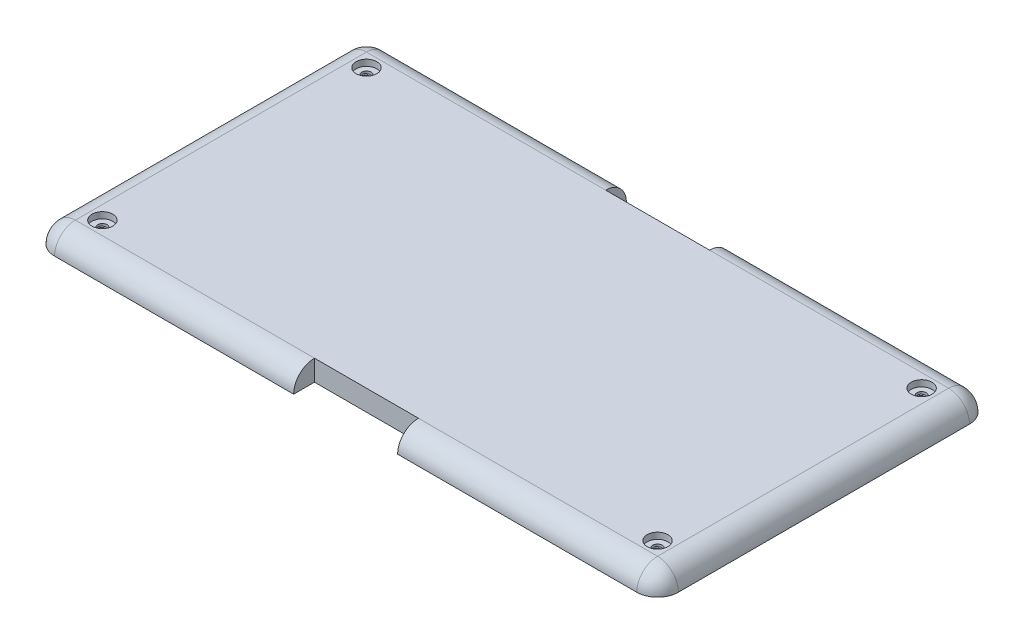
from build123d import *

# Parameters (mm, degrees)
ESQUISSE1_W             = 300
ESQUISSE1_H             = 160
BOSS_EXTRU_1_DEPTH      = 10
CONG_1_R                = 10
CONG_2_R                = 10
CONG_4_R                = 10
ESQUISSE2_R             = 5
ESQUISSE2_R_2           = 2
ENL_V_MAT_EXTRU_1_DEPTH = 3
ESQUISSE4_R             = 2.25
ENL_V_MAT_EXTRU_2_DEPTH = 13
ESQUISSE5_R             = 2.25
ENL_V_MAT_EXTRU_3_DEPTH = 13
ESQUISSE7_W             = 25
ESQUISSE7_H             = 22.883297183
ESQUISSE7_H_2           = 22.436620545
ENL_V_MAT_EXTRU_5_DEPTH = 25
FILETAGE1_PITCH         = 0.8
FILETAGE2_PITCH         = 0.8
FILETAGE3_PITCH         = 0.8
FILETAGE4_PITCH         = 0.8


with BuildPart() as part:
    # Esquisse1 → Boss.-Extru.1 (new body)
    with BuildSketch(Plane(origin=(0, 0, 0), x_dir=(1, 0, 0), z_dir=(0, 1, 0))):
        Rectangle(ESQUISSE1_W, ESQUISSE1_H)
    extrude(amount=BOSS_EXTRU_1_DEPTH)

    # Congé1
    cong_1_edges = [part.edges().sort_by_distance(p)[0] for p in [
        (-150, 5, -80),
    ]]
    fillet(cong_1_edges, radius=CONG_1_R)

    # Congé2
    cong_2_edges = [part.edges().sort_by_distance(p)[0] for p in [
        (150, 5, -80),
        (150, 5, 80),
        (-150, 5, 80),
    ]]
    fillet(cong_2_edges, radius=CONG_2_R)

    # Congé4
    cong_4_edges = [part.edges().sort_by_distance(p)[0] for p in [
        (-147.071067812, 10, -77.071067812),
        (0, 10, -80),
        (147.071067812, 10, -77.071067812),
        (150, 10, 0),
        (147.071067812, 10, 77.071067812),
        (0, 10, 80),
        (-147.071067812, 10, 77.071067812),
        (-150, 10, 0),
    ]]
    fillet(cong_4_edges, radius=CONG_4_R - 0.0001)  # a hair under: the kernel refuses the full size

    # Esquisse2 → Enlèv. mat.-Extru.1 (cut)
    # profile 1 of 4: a face of its own
    with BuildSketch(Plane(origin=(0, 10, 0), x_dir=(1, 0, 0), z_dir=(0, 1, 0))):
        with Locations(Location((-133.5, 63.5, 0), (0, 0, 270))):
            Circle(ESQUISSE2_R)
    # profile 2 of 4: a face of its own
    with BuildSketch(Plane(origin=(0, 10, 0), x_dir=(1, 0, 0), z_dir=(0, 1, 0))):
        with Locations(Location((-133.5, -63.5, 0), (0, 0, 270))):
            Circle(ESQUISSE2_R)
    # profile 3 of 4: a face of its own
    with BuildSketch(Plane(origin=(0, 10, 0), x_dir=(1, 0, 0), z_dir=(0, 1, 0))):
        with Locations(Location((133.5, -63.5, 0), (0, 0, 270))):
            Circle(ESQUISSE2_R)
        with Locations(Location((133.5, -63.5, 0), (0, 0, 270))):
            Circle(ESQUISSE2_R_2, mode=Mode.SUBTRACT)
    # profile 4 of 4: a face of its own
    with BuildSketch(Plane(origin=(0, 10, 0), x_dir=(1, 0, 0), z_dir=(0, 1, 0))):
        with Locations(Location((133.5, 63.5, 0), (0, 0, 270))):
            Circle(ESQUISSE2_R)
    extrude(amount=-ENL_V_MAT_EXTRU_1_DEPTH, mode=Mode.SUBTRACT)

    # Esquisse4 → Enlèv. mat.-Extru.2 (cut)
    with BuildSketch(Plane(origin=(0, 10, 0), x_dir=(1, 0, 0), z_dir=(0, 1, 0))):
        with Locations(Location((133.5, -63.5, 0), (0, 0, 270))):
            Circle(ESQUISSE4_R)
    extrude(amount=-ENL_V_MAT_EXTRU_2_DEPTH, mode=Mode.SUBTRACT)

    # Esquisse5 → Enlèv. mat.-Extru.3 (cut)
    with BuildSketch(Plane(origin=(0, 7, 0), x_dir=(1, 0, 0), z_dir=(0, 1, 0))):
        with Locations(Location((133.5, 63.5, 0), (0, 0, 270))):
            Circle(ESQUISSE5_R)
        with Locations(Location((-133.5, 63.5, 0), (0, 0, 270))):
            Circle(ESQUISSE5_R)
        with Locations(Location((-133.5, -63.5, 0), (0, 0, 270))):
            Circle(ESQUISSE5_R)
    extrude(amount=-ENL_V_MAT_EXTRU_3_DEPTH, mode=Mode.SUBTRACT)

    # Esquisse7 → Enlèv. mat.-Extru.5 (cut, symmetric)
    with BuildSketch(Plane(origin=(0, 10, 0), x_dir=(1, 0, 0), z_dir=(0, 1, 0))):
        with Locations((-12.5, 81.441648592)):
            Rectangle(ESQUISSE7_W, ESQUISSE7_H)
        with Locations((12.5, 81.441648592)):
            Rectangle(ESQUISSE7_W, ESQUISSE7_H)
        with Locations((-12.5, -81.218310273)):
            Rectangle(ESQUISSE7_W, ESQUISSE7_H_2)
        with Locations((12.5, -81.218310273)):
            Rectangle(ESQUISSE7_W, ESQUISSE7_H_2)
    extrude(amount=ENL_V_MAT_EXTRU_5_DEPTH, both=True, mode=Mode.SUBTRACT)

    # Filetage1: arcs per turn and ends read off the stored shape
    # Filetage1: the profile of Profil de filetage1 profile screwed along a right-hand helix through 6.25 turns, 8 arcs to a turn; built about Z, then put on its axis
    filetage1_z = Axis((0, 0, 0), (0, 0, 1))
    filetage1_corners = [(2.2503, 0, -0.000173205), (2.2503, 0, 0.700173203), (1.8169873, 0, 0.449999999), (1.8169873, 0, 0.249999999)]
    with BuildLine(mode=Mode.PRIVATE) as filetage1_profile:
        Line(filetage1_corners[0], filetage1_corners[1])
        Line(filetage1_corners[1], filetage1_corners[2])
        Line(filetage1_corners[2], filetage1_corners[3])
        Line(filetage1_corners[3], filetage1_corners[0])
    filetage1_cap = Face(filetage1_profile.wire())
    filetage1_turn_angles = [0, 22.5, 45, 67.5, 90, 112.5, 135, 157.5, 180, 202.5, 225, 247.5, 270, 292.5, 315, 337.5, 360]
    filetage1_turn_weights = [1, 0.9238795325112867, 1, 0.9238795325112867, 1, 0.9238795325112867, 1, 0.9238795325112867, 1, 0.9238795325112867, 1, 0.9238795325112867, 1, 0.9238795325112867, 1, 0.9238795325112867, 1]
    filetage1_turn_rails = [Edge.make_bspline([Vector(p[0], p[1], 0).rotate(filetage1_z, filetage1_turn_angles[k]) / filetage1_turn_weights[k] + Vector(0, 0, p[2] + FILETAGE1_PITCH * filetage1_turn_angles[k] / 360) for k in range(17)], [0, 0, 0, 1, 1, 2, 2, 3, 3, 4, 4, 5, 5, 6, 6, 7, 7, 8, 8, 8], 2, filetage1_turn_weights) for p in filetage1_corners]
    filetage1_turn_sides = [Face.make_surface_from_curves(filetage1_turn_rails[p[0]], filetage1_turn_rails[p[1]]) for p in [(0, 1), (1, 2), (2, 3), (3, 0)]]
    filetage1_last_angles = [2160, 2182.5, 2205, 2227.5, 2250]
    filetage1_last_weights = [1, 0.9238795325112867, 1, 0.9238795325112867, 1]
    filetage1_last_rails = [Edge.make_bspline([Vector(p[0], p[1], 0).rotate(filetage1_z, filetage1_last_angles[k]) / filetage1_last_weights[k] + Vector(0, 0, p[2] + FILETAGE1_PITCH * filetage1_last_angles[k] / 360) for k in range(5)], [0, 0, 0, 1, 1, 2, 2, 2], 2, filetage1_last_weights) for p in filetage1_corners]
    filetage1_last_sides = [Face.make_surface_from_curves(filetage1_last_rails[p[0]], filetage1_last_rails[p[1]]) for p in [(0, 1), (1, 2), (2, 3), (3, 0)]]
    filetage1 = Plane(origin=(-133.5, 6, -63.5), x_dir=(-1, 0, 0), z_dir=(0, -1, 0)) * Solid(Shell([*[p.moved(Location((0, 0, FILETAGE1_PITCH * i))) for i in range(6) for p in filetage1_turn_sides], *filetage1_last_sides, filetage1_cap, filetage1_cap.rotate(filetage1_z, 2250).moved(Location((0, 0, FILETAGE1_PITCH * 2250 / 360)))]))
    add(filetage1)

    # Filetage2: arcs per turn and ends read off the stored shape
    # Filetage2: the profile of Profil de filetage2 profile screwed along a right-hand helix through 6.25 turns, 8 arcs to a turn; built about Z, then put on its axis
    filetage2_z = Axis((0, 0, 0), (0, 0, 1))
    filetage2_corners = [(2.2503, 0, -0.000173205), (2.2503, 0, 0.700173203), (1.8169873, 0, 0.449999999), (1.8169873, 0, 0.249999999)]
    with BuildLine(mode=Mode.PRIVATE) as filetage2_profile:
        Line(filetage2_corners[0], filetage2_corners[1])
        Line(filetage2_corners[1], filetage2_corners[2])
        Line(filetage2_corners[2], filetage2_corners[3])
        Line(filetage2_corners[3], filetage2_corners[0])
    filetage2_cap = Face(filetage2_profile.wire())
    filetage2_turn_angles = [0, 22.5, 45, 67.5, 90, 112.5, 135, 157.5, 180, 202.5, 225, 247.5, 270, 292.5, 315, 337.5, 360]
    filetage2_turn_weights = [1, 0.9238795325112867, 1, 0.9238795325112867, 1, 0.9238795325112867, 1, 0.9238795325112867, 1, 0.9238795325112867, 1, 0.9238795325112867, 1, 0.9238795325112867, 1, 0.9238795325112867, 1]
    filetage2_turn_rails = [Edge.make_bspline([Vector(p[0], p[1], 0).rotate(filetage2_z, filetage2_turn_angles[k]) / filetage2_turn_weights[k] + Vector(0, 0, p[2] + FILETAGE2_PITCH * filetage2_turn_angles[k] / 360) for k in range(17)], [0, 0, 0, 1, 1, 2, 2, 3, 3, 4, 4, 5, 5, 6, 6, 7, 7, 8, 8, 8], 2, filetage2_turn_weights) for p in filetage2_corners]
    filetage2_turn_sides = [Face.make_surface_from_curves(filetage2_turn_rails[p[0]], filetage2_turn_rails[p[1]]) for p in [(0, 1), (1, 2), (2, 3), (3, 0)]]
    filetage2_last_angles = [2160, 2182.5, 2205, 2227.5, 2250]
    filetage2_last_weights = [1, 0.9238795325112867, 1, 0.9238795325112867, 1]
    filetage2_last_rails = [Edge.make_bspline([Vector(p[0], p[1], 0).rotate(filetage2_z, filetage2_last_angles[k]) / filetage2_last_weights[k] + Vector(0, 0, p[2] + FILETAGE2_PITCH * filetage2_last_angles[k] / 360) for k in range(5)], [0, 0, 0, 1, 1, 2, 2, 2], 2, filetage2_last_weights) for p in filetage2_corners]
    filetage2_last_sides = [Face.make_surface_from_curves(filetage2_last_rails[p[0]], filetage2_last_rails[p[1]]) for p in [(0, 1), (1, 2), (2, 3), (3, 0)]]
    filetage2 = Plane(origin=(-133.5, 6, 63.5), x_dir=(-1, 0, 0), z_dir=(0, -1, 0)) * Solid(Shell([*[p.moved(Location((0, 0, FILETAGE2_PITCH * i))) for i in range(6) for p in filetage2_turn_sides], *filetage2_last_sides, filetage2_cap, filetage2_cap.rotate(filetage2_z, 2250).moved(Location((0, 0, FILETAGE2_PITCH * 2250 / 360)))]))
    add(filetage2)

    # Filetage3: arcs per turn and ends read off the stored shape
    # Filetage3: the profile of Profil de filetage3 profile screwed along a right-hand helix through 6.25 turns, 8 arcs to a turn; built about Z, then put on its axis
    filetage3_z = Axis((0, 0, 0), (0, 0, 1))
    filetage3_corners = [(2.2503, 0, -0.000173205), (2.2503, 0, 0.700173203), (1.8169873, 0, 0.449999999), (1.8169873, 0, 0.249999999)]
    with BuildLine(mode=Mode.PRIVATE) as filetage3_profile:
        Line(filetage3_corners[0], filetage3_corners[1])
        Line(filetage3_corners[1], filetage3_corners[2])
        Line(filetage3_corners[2], filetage3_corners[3])
        Line(filetage3_corners[3], filetage3_corners[0])
    filetage3_cap = Face(filetage3_profile.wire())
    filetage3_turn_angles = [0, 22.5, 45, 67.5, 90, 112.5, 135, 157.5, 180, 202.5, 225, 247.5, 270, 292.5, 315, 337.5, 360]
    filetage3_turn_weights = [1, 0.9238795325112867, 1, 0.9238795325112867, 1, 0.9238795325112867, 1, 0.9238795325112867, 1, 0.9238795325112867, 1, 0.9238795325112867, 1, 0.9238795325112867, 1, 0.9238795325112867, 1]
    filetage3_turn_rails = [Edge.make_bspline([Vector(p[0], p[1], 0).rotate(filetage3_z, filetage3_turn_angles[k]) / filetage3_turn_weights[k] + Vector(0, 0, p[2] + FILETAGE3_PITCH * filetage3_turn_angles[k] / 360) for k in range(17)], [0, 0, 0, 1, 1, 2, 2, 3, 3, 4, 4, 5, 5, 6, 6, 7, 7, 8, 8, 8], 2, filetage3_turn_weights) for p in filetage3_corners]
    filetage3_turn_sides = [Face.make_surface_from_curves(filetage3_turn_rails[p[0]], filetage3_turn_rails[p[1]]) for p in [(0, 1), (1, 2), (2, 3), (3, 0)]]
    filetage3_last_angles = [2160, 2182.5, 2205, 2227.5, 2250]
    filetage3_last_weights = [1, 0.9238795325112867, 1, 0.9238795325112867, 1]
    filetage3_last_rails = [Edge.make_bspline([Vector(p[0], p[1], 0).rotate(filetage3_z, filetage3_last_angles[k]) / filetage3_last_weights[k] + Vector(0, 0, p[2] + FILETAGE3_PITCH * filetage3_last_angles[k] / 360) for k in range(5)], [0, 0, 0, 1, 1, 2, 2, 2], 2, filetage3_last_weights) for p in filetage3_corners]
    filetage3_last_sides = [Face.make_surface_from_curves(filetage3_last_rails[p[0]], filetage3_last_rails[p[1]]) for p in [(0, 1), (1, 2), (2, 3), (3, 0)]]
    filetage3 = Plane(origin=(133.5, 6, -63.5), x_dir=(-1, 0, 0), z_dir=(0, -1, 0)) * Solid(Shell([*[p.moved(Location((0, 0, FILETAGE3_PITCH * i))) for i in range(6) for p in filetage3_turn_sides], *filetage3_last_sides, filetage3_cap, filetage3_cap.rotate(filetage3_z, 2250).moved(Location((0, 0, FILETAGE3_PITCH * 2250 / 360)))]))
    add(filetage3)

    # Filetage4: arcs per turn and ends read off the stored shape
    # Filetage4: the profile of Profil de filetage4 profile screwed along a right-hand helix through 6.25 turns, 8 arcs to a turn; built about Z, then put on its axis
    filetage4_z = Axis((0, 0, 0), (0, 0, 1))
    filetage4_corners = [(2.2503, 0, -0.000173205), (2.2503, 0, 0.700173203), (1.8169873, 0, 0.449999999), (1.8169873, 0, 0.249999999)]
    with BuildLine(mode=Mode.PRIVATE) as filetage4_profile:
        Line(filetage4_corners[0], filetage4_corners[1])
        Line(filetage4_corners[1], filetage4_corners[2])
        Line(filetage4_corners[2], filetage4_corners[3])
        Line(filetage4_corners[3], filetage4_corners[0])
    filetage4_cap = Face(filetage4_profile.wire())
    filetage4_turn_angles = [0, 22.5, 45, 67.5, 90, 112.5, 135, 157.5, 180, 202.5, 225, 247.5, 270, 292.5, 315, 337.5, 360]
    filetage4_turn_weights = [1, 0.9238795325112867, 1, 0.9238795325112867, 1, 0.9238795325112867, 1, 0.9238795325112867, 1, 0.9238795325112867, 1, 0.9238795325112867, 1, 0.9238795325112867, 1, 0.9238795325112867, 1]
    filetage4_turn_rails = [Edge.make_bspline([Vector(p[0], p[1], 0).rotate(filetage4_z, filetage4_turn_angles[k]) / filetage4_turn_weights[k] + Vector(0, 0, p[2] + FILETAGE4_PITCH * filetage4_turn_angles[k] / 360) for k in range(17)], [0, 0, 0, 1, 1, 2, 2, 3, 3, 4, 4, 5, 5, 6, 6, 7, 7, 8, 8, 8], 2, filetage4_turn_weights) for p in filetage4_corners]
    filetage4_turn_sides = [Face.make_surface_from_curves(filetage4_turn_rails[p[0]], filetage4_turn_rails[p[1]]) for p in [(0, 1), (1, 2), (2, 3), (3, 0)]]
    filetage4_last_angles = [2160, 2182.5, 2205, 2227.5, 2250]
    filetage4_last_weights = [1, 0.9238795325112867, 1, 0.9238795325112867, 1]
    filetage4_last_rails = [Edge.make_bspline([Vector(p[0], p[1], 0).rotate(filetage4_z, filetage4_last_angles[k]) / filetage4_last_weights[k] + Vector(0, 0, p[2] + FILETAGE4_PITCH * filetage4_last_angles[k] / 360) for k in range(5)], [0, 0, 0, 1, 1, 2, 2, 2], 2, filetage4_last_weights) for p in filetage4_corners]
    filetage4_last_sides = [Face.make_surface_from_curves(filetage4_last_rails[p[0]], filetage4_last_rails[p[1]]) for p in [(0, 1), (1, 2), (2, 3), (3, 0)]]
    filetage4 = Plane(origin=(133.5, 6, 63.5), x_dir=(-1, 0, 0), z_dir=(0, -1, 0)) * Solid(Shell([*[p.moved(Location((0, 0, FILETAGE4_PITCH * i))) for i in range(6) for p in filetage4_turn_sides], *filetage4_last_sides, filetage4_cap, filetage4_cap.rotate(filetage4_z, 2250).moved(Location((0, 0, FILETAGE4_PITCH * 2250 / 360)))]))
    add(filetage4)


solid = part.part
